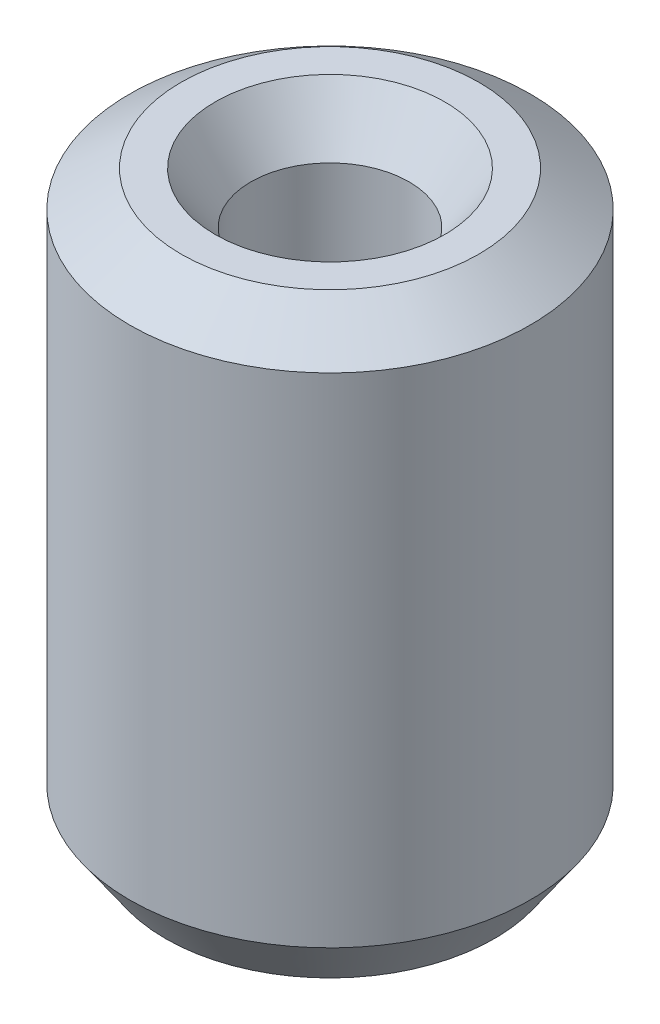
from build123d import *
from OCP.BRepFilletAPI import BRepFilletAPI_MakeChamfer

# Parameters (mm, degrees)
SKETCH1_R           = 10
BOSS_EXTRUDE1_DEPTH = 29.212820598
SKETCH2_R           = 3.951209938
CUT_EXTRUDE1_DEPTH  = 33.455953034
CHAMFER1_SIZE       = 1.785515995
CHAMFER1_SIZE2      = 2.564809476


with BuildPart() as part:
    # Sketch1 → Boss-Extrude1 (new body)
    with BuildSketch(Plane(origin=(0, 0, 0), x_dir=(1, 0, 0), z_dir=(0, 1, 0))):
        Circle(SKETCH1_R)
    extrude(amount=BOSS_EXTRUDE1_DEPTH)

    # Sketch2 → Cut-Extrude1 (cut, through all)
    with BuildSketch(Plane(origin=(0, 0, 0), x_dir=(1, 0, 0), z_dir=(0, 1, 0))):
        Circle(SKETCH2_R)
    extrude(amount=CUT_EXTRUDE1_DEPTH, mode=Mode.SUBTRACT)

    # Chamfer1: one chamfer whose edges measure the first distance from different faces: ONE call of the kernel's chamfer builder (chamfer() names one face for all edges)
    chamfer1_edges_1 = [part.edges().sort_by_distance(p)[0] for p in [
        (-3.951209938, 29.212820598, 0),
    ]]
    chamfer1_side_1 = [part.faces().sort_by_distance(p)[0] for p in [
        (-9.717157288, 29.212820598, 0),
    ]]
    chamfer1_edges_2 = [part.edges().sort_by_distance(p)[0] for p in [
        (-3.951209938, 0, 0),
    ]]
    chamfer1_side_2 = [part.faces().sort_by_distance(p)[0] for p in [
        (-3.951209938, 14.606410299, 0),
    ]]
    chamfer1_edges_3 = [part.edges().sort_by_distance(p)[0] for p in [
        (-10, 0, 0),
    ]]
    chamfer1_side_3 = [part.faces().sort_by_distance(p)[0] for p in [
        (-9.717157288, 0, 0),
    ]]
    chamfer1_edges_4 = [part.edges().sort_by_distance(p)[0] for p in [
        (-10, 29.212820598, 0),
    ]]
    chamfer1_side_4 = [part.faces().sort_by_distance(p)[0] for p in [
        (-10, 14.606410299, 0),
    ]]
    chamfer1 = BRepFilletAPI_MakeChamfer(part.part.solid().wrapped)
    for e in chamfer1_edges_1:
        chamfer1.Add(CHAMFER1_SIZE, CHAMFER1_SIZE2, e.wrapped, chamfer1_side_1[0].wrapped)  # the first distance lies on this face
    for e in chamfer1_edges_2:
        chamfer1.Add(CHAMFER1_SIZE, CHAMFER1_SIZE2, e.wrapped, chamfer1_side_2[0].wrapped)  # the first distance lies on this face
    for e in chamfer1_edges_3:
        chamfer1.Add(CHAMFER1_SIZE, CHAMFER1_SIZE2, e.wrapped, chamfer1_side_3[0].wrapped)  # the first distance lies on this face
    for e in chamfer1_edges_4:
        chamfer1.Add(CHAMFER1_SIZE, CHAMFER1_SIZE2, e.wrapped, chamfer1_side_4[0].wrapped)  # the first distance lies on this face
    add(Compound.cast(chamfer1.Shape()), mode=Mode.REPLACE)


solid = part.part
